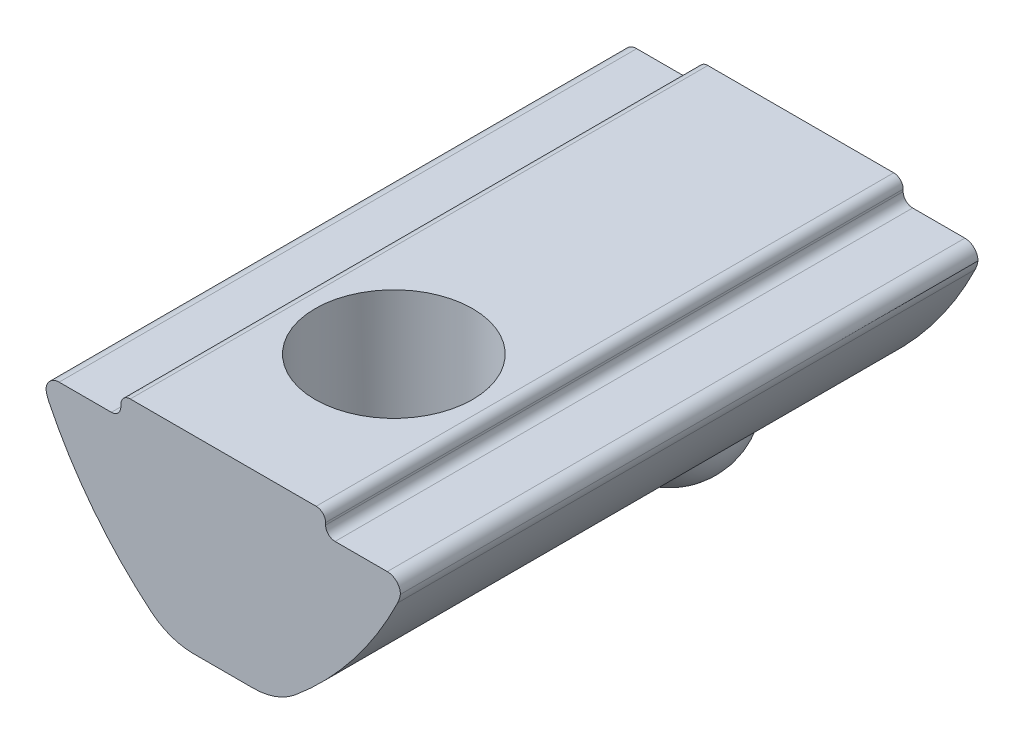
from build123d import *

# Parameters (mm, degrees)
SKETCH1_R           = 3
BOSS_EXTRUDE1_DEPTH = 16
CUT_SWEEP1_PITCH    = 1
SKETCH4_OUTSIDE_W   = 13.622
SKETCH4_OUTSIDE_H   = 13.622
SKETCH4_OUTSIDE_R   = 2.242227772
CUT_EXTRUDE1_DEPTH  = 1
CUT_EXTRUDE1_DRAFT  = -45
CUT_EXTRUDE2_DEPTH  = 2.4
BOSS_EXTRUDE2_START = 6.5
BOSS_EXTRUDE2_DEPTH = 22
SKETCH9_R           = 3
CUT_EXTRUDE4_DEPTH  = 24.276866267
SKETCH10_W          = 2.5
SKETCH10_H          = 6


with BuildPart() as part:
    # Sketch1 → Boss-Extrude1 (new body)
    with BuildSketch(Plane(origin=(0, 0, 0), x_dir=(1, 0, 0), z_dir=(0, 1, 0))):
        with Locations(Location((0, 0, 0), (0, 0, 270))):
            Circle(SKETCH1_R)
    extrude(amount=-BOSS_EXTRUDE1_DEPTH)

    # Cut-Sweep1: arcs per turn and ends read off the stored shape
    # Cut-Sweep1: the profile of Sketch3 screwed along a right-hand helix through 18 turns, 8 arcs to a turn; built about Z, then put on its axis
    cut_sweep1_z = Axis((0, 0, 0), (0, 0, 1))
    cut_sweep1_corners = [(2.350480947, 0, -1.375), (3.054126588, 0, -0.96875), (3.054126588, 0, -1.90625), (2.350480947, 0, -1.5)]
    with BuildLine(mode=Mode.PRIVATE) as cut_sweep1_profile:
        Line(cut_sweep1_corners[0], cut_sweep1_corners[1])
        Line(cut_sweep1_corners[1], cut_sweep1_corners[2])
        Line(cut_sweep1_corners[2], cut_sweep1_corners[3])
        Line(cut_sweep1_corners[3], cut_sweep1_corners[0])
    cut_sweep1_cap = Face(cut_sweep1_profile.wire())
    cut_sweep1_turn_angles = [0, 22.5, 45, 67.5, 90, 112.5, 135, 157.5, 180, 202.5, 225, 247.5, 270, 292.5, 315, 337.5, 360]
    cut_sweep1_turn_weights = [1, 0.9238795325112867, 1, 0.9238795325112867, 1, 0.9238795325112867, 1, 0.9238795325112867, 1, 0.9238795325112867, 1, 0.9238795325112867, 1, 0.9238795325112867, 1, 0.9238795325112867, 1]
    cut_sweep1_turn_rails = [Edge.make_bspline([Vector(p[0], p[1], 0).rotate(cut_sweep1_z, cut_sweep1_turn_angles[k]) / cut_sweep1_turn_weights[k] + Vector(0, 0, p[2] + CUT_SWEEP1_PITCH * cut_sweep1_turn_angles[k] / 360) for k in range(17)], [0, 0, 0, 1, 1, 2, 2, 3, 3, 4, 4, 5, 5, 6, 6, 7, 7, 8, 8, 8], 2, cut_sweep1_turn_weights) for p in cut_sweep1_corners]
    cut_sweep1_turn_sides = [Face.make_surface_from_curves(cut_sweep1_turn_rails[p[0]], cut_sweep1_turn_rails[p[1]]) for p in [(0, 1), (1, 2), (2, 3), (3, 0)]]
    cut_sweep1 = Plane(origin=(0, -16, 0), x_dir=(0, 0, -1), z_dir=(0, 1, 0)) * Solid(Shell([*[p.moved(Location((0, 0, CUT_SWEEP1_PITCH * i))) for i in range(18) for p in cut_sweep1_turn_sides], cut_sweep1_cap, cut_sweep1_cap.rotate(cut_sweep1_z, 6480).moved(Location((0, 0, CUT_SWEEP1_PITCH * 6480 / 360)))]))
    add(cut_sweep1, mode=Mode.SUBTRACT)


with BuildPart() as cut_extrude1_tool:
    # Sketch4 outside → Cut-Extrude1 (with draft: the straight prism first)
    with BuildSketch(Plane.XZ.offset(16)):
        Rectangle(SKETCH4_OUTSIDE_W, SKETCH4_OUTSIDE_H)
        Circle(SKETCH4_OUTSIDE_R, mode=Mode.SUBTRACT)
    extrude(amount=-CUT_EXTRUDE1_DEPTH)
    # Cut-Extrude1: the draft: its side faces are tilted about the plane it starts from
    cut_extrude1_sides = [cut_extrude1_tool.faces().sort_by_distance(p)[0] for p in [
        (0, -15.5, -6.811),
        (6.811, -15.5, 0),
        (0, -15.5, 6.811),
        (-6.811, -15.5, 0),
        (-2.242227772, -15.5, 0),
    ]]
    draft(cut_extrude1_sides, Plane.XZ.offset(16), CUT_EXTRUDE1_DRAFT)


with BuildPart() as part_1:
    add(part.part)

    # Cut-Extrude1: cut by cut_extrude1_tool
    add(cut_extrude1_tool.part, mode=Mode.SUBTRACT)

    # Sketch5 → Revolve1 (revolve)
    with BuildSketch(Plane.XY, mode=Mode.PRIVATE) as revolve1_sk:
        with BuildLine():
            Line((0, 3.3), (0, 0))
            Line((0, 0), (-5.25, 0))
            Line((-5.25, 0), (-5.25, 0.825))
            ThreePointArc((-5.25, 0.825), (-4.306626435, 2.227614941), (-3, 3.3))
            Line((-3, 3.3), (0, 3.3))
        make_face()
    revolve(revolve1_sk.sketch.rotate(Axis((0, 0, 0), (0, -1, 0)), 90), axis=Axis((0, 0, 0), (0, -1, 0)))

    # Sketch6 → Cut-Extrude2 (cut)
    with BuildSketch(Plane(origin=(0, 3.3, 0), x_dir=(1, 0, 0), z_dir=(0, 1, 0))):
        Polygon((0, 2.309401077), (-2, 1.154700538), (-2, -1.154700538), (0, -2.309401077), (2, -1.154700538), (2, 1.154700538), align=None)
    extrude(amount=-CUT_EXTRUDE2_DEPTH, mode=Mode.SUBTRACT)

    # Cut-Extrude3 cone 1 section (through the dimple's axis) → Cut-Extrude3 (revolve, cut)
    with BuildSketch(Plane(origin=(0, 3.3, 0), x_dir=(0, 0, 1), z_dir=(1, 0, 0))):
        Polygon((0, 0), (2.309401077, 0), (0, 2.309401077), align=None)
    revolve(axis=Axis((0, 3.3, 0), (0, -1, 0)), mode=Mode.SUBTRACT)


with BuildPart() as body_2:
    # Sketch8 → Boss-Extrude2 (new body)
    with BuildSketch(Plane.XY.offset(BOSS_EXTRUDE2_START)):
        with BuildLine():
            Line((-1.141910018, -15.2), (1.141910018, -15.2))
            ThreePointArc((1.141910018, -15.2), (1.992150427, -15.050976658), (2.741026302, -14.621672998))
            ThreePointArc((2.741026302, -14.621672998), (4.957086228, -12.338580682), (6.641744362, -9.639440246))
            ThreePointArc((6.641744362, -9.639440246), (6.708027965, -9.473596894), (6.75, -9.3))
            ThreePointArc((6.75, -9.3), (6.603553391, -8.946446609), (6.25, -8.8))
            Line((6.25, -8.8), (4.26, -8.8))
            ThreePointArc((4.26, -8.8), (4.005441559, -8.694558441), (3.9, -8.44))
            Line((3.9, -8.44), (3.9, -8.36))
            ThreePointArc((3.9, -8.36), (3.794558441, -8.105441559), (3.54, -8))
            Line((3.54, -8), (-3.54, -8))
            ThreePointArc((-3.54, -8), (-3.794558441, -8.105441559), (-3.9, -8.36))
            Line((-3.9, -8.36), (-3.9, -8.44))
            ThreePointArc((-3.9, -8.44), (-4.005441559, -8.694558441), (-4.26, -8.8))
            Line((-4.26, -8.8), (-6.25, -8.8))
            ThreePointArc((-6.25, -8.8), (-6.603553391, -8.946446609), (-6.75, -9.3))
            ThreePointArc((-6.75, -9.3), (-6.708027965, -9.473596894), (-6.641744362, -9.639440246))
            ThreePointArc((-6.641744362, -9.639440246), (-4.957086228, -12.338580682), (-2.741026302, -14.621672998))
            ThreePointArc((-2.741026302, -14.621672998), (-1.992150427, -15.050976658), (-1.141910018, -15.2))
        make_face()
    extrude(amount=-BOSS_EXTRUDE2_DEPTH)

    # Sketch9 → Cut-Extrude4 (cut, through all)
    with BuildSketch(Plane(origin=(0, 0, 0), x_dir=(1, 0, 0), z_dir=(0, 1, 0))):
        with Locations(Location((0, 0, 0), (0, 0, 270))):
            Circle(SKETCH9_R)
    extrude(amount=-CUT_EXTRUDE4_DEPTH, mode=Mode.SUBTRACT)

    # Sketch10 → Cut-Revolve1 (revolve, cut)
    with BuildSketch(Plane(origin=(0, 0, 0), x_dir=(0, 0, -1), z_dir=(1, 0, 0))):
        with Locations((11.75, -12.2)):
            Rectangle(SKETCH10_W, SKETCH10_H)
    revolve(axis=Axis((0, -9.2, -10.5), (0, 1, 0)), mode=Mode.SUBTRACT)


with BuildPart() as body_3:
    # Sketch11 → Revolve2 (revolve)
    with BuildSketch(Plane(origin=(0, 0, 0), x_dir=(0, 0, -1), z_dir=(1, 0, 0))):
        with BuildLine():
            Line((10.5, -12.1), (10.5, -17.1))
            ThreePointArc((10.5, -17.1), (13, -14.6), (10.5, -12.1))
        make_face()
    revolve(axis=Axis((0, -12.1, -10.5), (0, -1, 0)))


solid = Compound([body_2.part, body_3.part])
